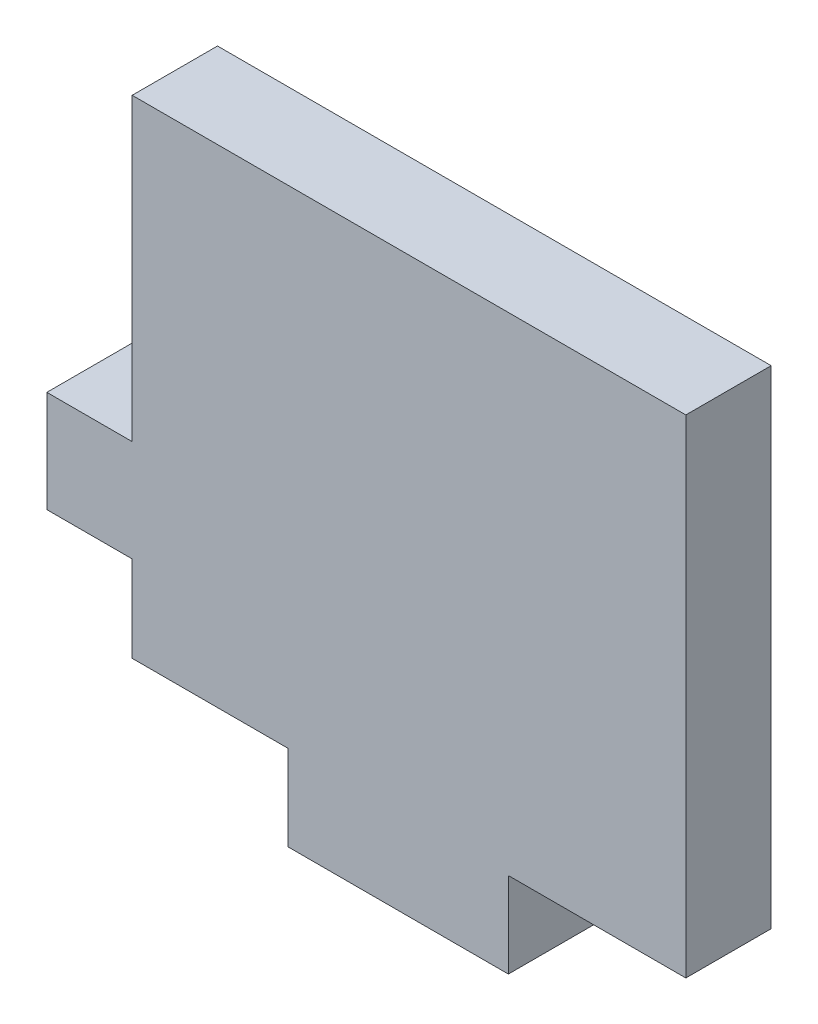
from build123d import *

# Parameters (mm, degrees)
SKETCH1_W           = 76.2
SKETCH1_H           = 30.48
BOSS_EXTRUDE1_DEPTH = 5.334
CAVITY1_START       = -171.988852232
CAVITY1_OUTLINE_W   = 30.48
CAVITY1_OUTLINE_H   = 5.334
CAVITY1_DEPTH       = 41.5925
SKETCH2_W           = 5.334
SKETCH2_H           = 6.35
BOSS_EXTRUDE2_DEPTH = 5.334
SKETCH3_W           = 13.788269566
SKETCH3_H           = 5.334
BOSS_EXTRUDE3_DEPTH = 5.334


# Read off the part's stored shape, not the designer's step: Cavity1
with BuildPart() as part:
    # Sketch1 → Boss-Extrude1 (new body)
    with BuildSketch(Plane.XY):
        with Locations((-133.888852232, -13.121247947)):
            Rectangle(SKETCH1_W, SKETCH1_H)
    extrude(amount=BOSS_EXTRUDE1_DEPTH)

    # Cavity1 outline → Cavity1 (cut)
    with BuildSketch(Plane.YZ.offset(CAVITY1_START)):
        with Locations((-13.121247947, 2.667)):
            Rectangle(CAVITY1_OUTLINE_W, CAVITY1_OUTLINE_H)
    extrude(amount=CAVITY1_DEPTH, mode=Mode.SUBTRACT)

    # Sketch2 → Boss-Extrude2 (add)
    with BuildSketch(Plane.XY.offset(5.334)):
        with Locations((-133.063352232, -19.80374181)):
            Rectangle(SKETCH2_W, SKETCH2_H)
    extrude(amount=-BOSS_EXTRUDE2_DEPTH)

    # Sketch3 → Boss-Extrude3 (add)
    with BuildSketch(Plane.XY.offset(5.334)):
        with Locations((-113.775970546, -31.028247947)):
            Rectangle(SKETCH3_W, SKETCH3_H)
    extrude(amount=-BOSS_EXTRUDE3_DEPTH)


solid = part.part
